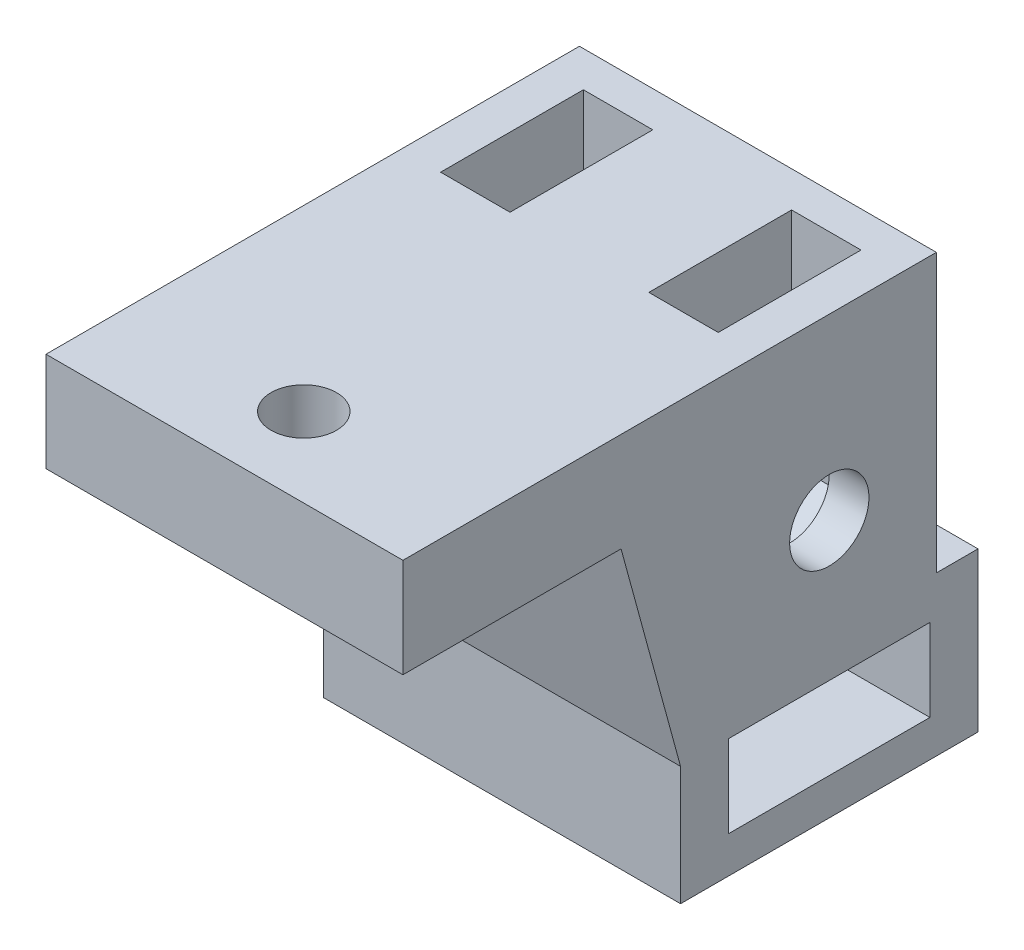
from build123d import *

# Parameters (mm, degrees)
IZIM1_W                     = 18
IZIM1_H                     = 15
Y_KSEKLIK_EKSTR_ZYON1_DEPTH = 16
IZIM4_R                     = 2
KES_EKSTR_ZYON3_DEPTH       = 26.223996511
IZIM5_W                     = 3.5
IZIM5_H                     = 7.2
KES_EKSTR_ZYON4_DEPTH       = 9
KES_EKSTR_ZYON6_DEPTH       = 1.75
KES_EKSTR_ZYON14_DEPTH      = 1.75
IZIM11_W                    = 18
IZIM11_H                    = 5
MAKAS_DELI_I_DEPTH          = 14
IZIM12_R                    = 1.65
KES_EKSTR_ZYON10_DEPTH      = 8
PAH1_SIZE                   = 11
PAH1_SIZE_2                 = 3
IZIM15_W                    = 18
IZIM15_H                    = 15
ALT_SLOT_DEPTH              = 6
IZIM16_W                    = 10.15
IZIM16_H                    = 4.15
IZIM16_W_2                  = 2.1
IZIM16_H_2                  = 14
KES_EKSTR_ZYON15_DEPTH      = 33.283896915


with BuildPart() as part:
    # Çizim1 → Yükseklik-Ekstrüzyon1 (new body)
    with BuildSketch(Plane(origin=(0, 0, 0), x_dir=(1, 0, 0), z_dir=(0, 1, 0))):
        Rectangle(IZIM1_W, IZIM1_H)
    extrude(amount=Y_KSEKLIK_EKSTR_ZYON1_DEPTH)

    # Çizim4 → Kes-Ekstrüzyon3 (cut, through all)
    with BuildSketch(Plane.ZY.offset(9)):
        with Locations((0, 7)):
            Circle(IZIM4_R)
    extrude(amount=-KES_EKSTR_ZYON3_DEPTH, mode=Mode.SUBTRACT)

    # Çizim5 → Kes-Ekstrüzyon4 (cut)
    with BuildSketch(Plane(origin=(0, 16, 0), x_dir=(1, 0, 0), z_dir=(0, 1, 0))):
        with Locations((5.25, 0)):
            Rectangle(IZIM5_W, IZIM5_H)
        with Locations((-5.25, 0)):
            Rectangle(IZIM5_W, IZIM5_H)
    extrude(amount=-KES_EKSTR_ZYON4_DEPTH, mode=Mode.SUBTRACT)

    # Çizim6 → Kes-Ekstrüzyon6 (cut, symmetric)
    with BuildSketch(Plane.ZY.offset(-5.25)):
        Polygon((3.6, 9.078460969), (0, 11.156921938), (-3.6, 9.078460969), (-3.6, 4.921539031), (0, 2.843078062), (3.6, 4.921539031), align=None)
    extrude(amount=KES_EKSTR_ZYON6_DEPTH, both=True, mode=Mode.SUBTRACT)

    # Çizim14 → Kes-Ekstrüzyon14 (cut, symmetric)
    with BuildSketch(Plane.ZY.offset(5.25)):
        Polygon((3.6, 9.078460969), (0, 11.156921938), (-3.6, 9.078460969), (-3.6, 4.921539031), (0, 2.843078062), (3.6, 4.921539031), align=None)
    extrude(amount=KES_EKSTR_ZYON14_DEPTH, both=True, mode=Mode.SUBTRACT)

    # Çizim11 → makas deliği (add)
    with BuildSketch(Plane(origin=(0, 0, 7.5), x_dir=(-1, 0, 0), z_dir=(0, 0, -1))):
        with Locations((0, 13.5)):
            Rectangle(IZIM11_W, IZIM11_H)
    extrude(amount=-MAKAS_DELI_I_DEPTH)

    # Çizim12 → Kes-Ekstrüzyon10 (cut)
    with BuildSketch(Plane(origin=(0, 16, 0), x_dir=(1, 0, 0), z_dir=(0, 1, 0))):
        with Locations(Location((0, -17.5, 0), (0, 0, 270))):
            Circle(IZIM12_R)
    extrude(amount=-KES_EKSTR_ZYON10_DEPTH, mode=Mode.SUBTRACT)

    # Pah1
    # the kernel refuses this chamfer: 11, 3 mm, written as the material it adds along each edge
    with BuildSketch(Plane(origin=(9, 11, 7.5), x_dir=(0, -0.9999486586881362, -0.010133113430599267), z_dir=(-1, 0, 0))) as pah1_piece_1_section:
        Polygon((PAH1_SIZE * 0.999948658688, PAH1_SIZE * 0.0101331134306), (-PAH1_SIZE_2 * 0.0101331134306, PAH1_SIZE_2 * 0.999948658688), (0, 0), align=None)
    pah1_piece_1 = extrude(amount=18, mode=Mode.PRIVATE)
    pah1_piece_1 = split(pah1_piece_1, bisect_by=Plane(origin=(0, 0, 8.392972415), z_dir=(0, 1, 0)), keep=Keep.TOP, mode=Mode.PRIVATE)
    add(pah1_piece_1)

    # Çizim15 → alt slot (add)
    with BuildSketch(Plane.XZ):
        Rectangle(IZIM15_W, IZIM15_H)
    extrude(amount=ALT_SLOT_DEPTH)

    # Çizim16 → Kes-Ekstrüzyon15 (cut, through all)
    with BuildSketch(Plane.ZY.offset(9)):
        with Locations((0, -2.075)):
            Rectangle(IZIM16_W, IZIM16_H)
        with Locations((-6.45, 9)):
            Rectangle(IZIM16_W_2, IZIM16_H_2)
    extrude(amount=-KES_EKSTR_ZYON15_DEPTH, mode=Mode.SUBTRACT)


solid = part.part
